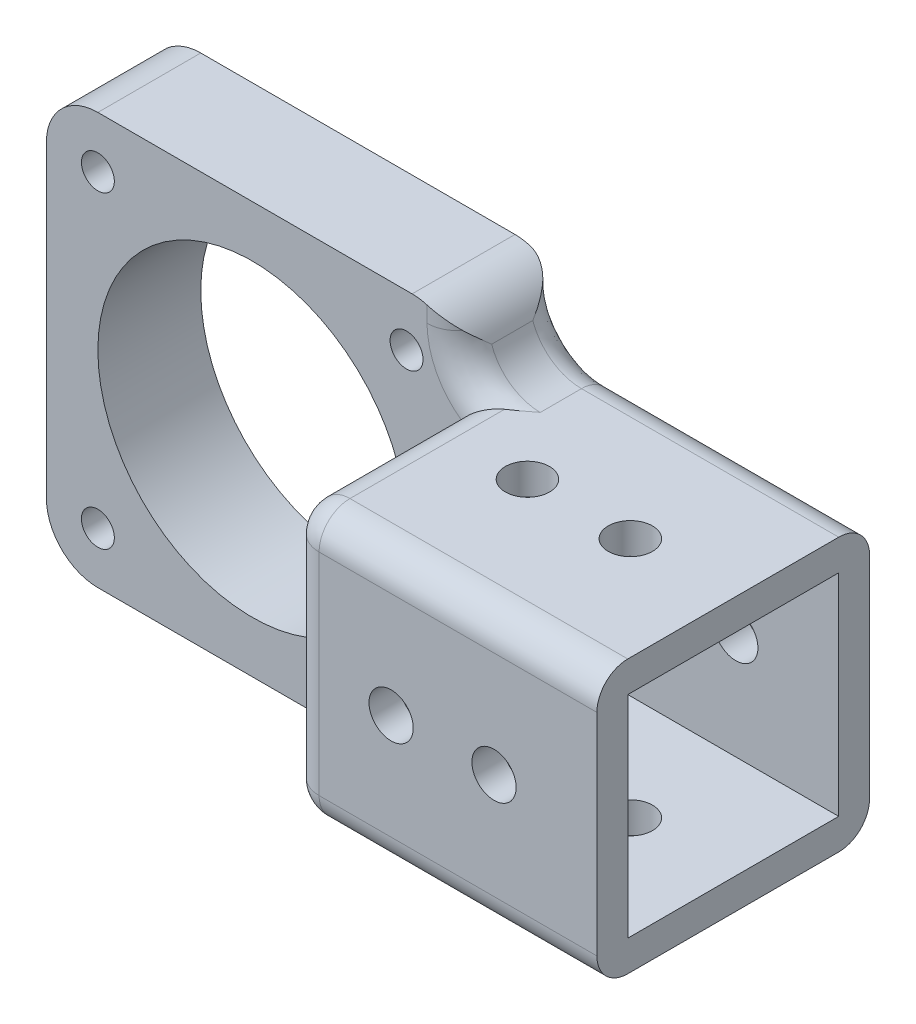
from build123d import *

# Parameters (mm, degrees)
SKETCH_1_W           = 17.5
SKETCH_1_H           = 17.5
EXTRUDE_1_DEPTH      = 30
SKETCH_2_W           = 20.5
SKETCH_2_H           = 20.5
SKETCH_2_W_2         = 17.5
SKETCH_2_H_2         = 17.5
EXTRUDE_2_DEPTH      = 2
SKETCH_3_W           = 26.5
SKETCH_3_H           = 26.5
SKETCH_3_W_2         = 20.5
SKETCH_3_H_2         = 20.5
EXTRUDE_3_DEPTH      = 30
SKETCH_4_R           = 2.15
CUT_EXTRUDE_6_DEPTH  = 43.164113888
SKETCH_6_W           = 10
SKETCH_6_H           = 26.5
SKETCH_6_H_2         = 6.75
EXTRUDE_5_DEPTH      = 40
SKETCH_14_R          = 1.6
CUT_EXTRUDE_9_DEPTH  = 52.983170353
FILLET_START         = -13.25
FILLET_25_DEPTH      = 10
FILLET_26_DEPTH      = 10
FILLET_28_R          = 3
FILLET_29_R          = 3
FILLET_30_R          = 3
FILLET_31_R          = 3
FILLET_32_R          = 3
FILLET_33_R          = 3
FILLET_34_R          = 3
FILLET_35_R          = 5
FILLET_START_2       = -14
FILLET_36_DEPTH      = 12
FILLET_37_DEPTH      = 12
FILLET_38_R          = 5
SKETCH_5_R           = 2.15
CUT_EXTRUDE_10_DEPTH = 52.983170469
SKETCH_15_W          = 17.5
SKETCH_15_H          = 17.5
CUT_EXTRUDE_12_DEPTH = 28


with BuildPart() as part:
    # 草图1 → 凸台-拉伸1 (new body)
    with BuildSketch(Plane(origin=(0, 0, 0), x_dir=(0, 0, -1), z_dir=(1, 0, 0))):
        Rectangle(SKETCH_1_W, SKETCH_1_H)
    extrude(amount=EXTRUDE_1_DEPTH)

    # 草图2 → 凸台-拉伸2 (add)
    with BuildSketch(Plane.ZY):
        Rectangle(SKETCH_2_W, SKETCH_2_H)
        Rectangle(SKETCH_2_W_2, SKETCH_2_H_2, mode=Mode.SUBTRACT)
    extrude(amount=-EXTRUDE_2_DEPTH)

    # 草图3 → 凸台-拉伸3 (add)
    with BuildSketch(Plane.ZY):
        Rectangle(SKETCH_3_W, SKETCH_3_H)
        Rectangle(SKETCH_3_W_2, SKETCH_3_H_2, mode=Mode.SUBTRACT)
    extrude(amount=-EXTRUDE_3_DEPTH)

    # 草图4 → 切除-拉伸6 (cut, through all)
    with BuildSketch(Plane(origin=(0, 13.25, 0), x_dir=(1, 0, 0), z_dir=(0, 1, 0))):
        with Locations(Location((10, 0, 0), (0, 0, 270))):
            Circle(SKETCH_4_R)
        with Locations(Location((20, 0, 0), (0, 0, 270))):
            Circle(SKETCH_4_R)
    extrude(amount=-CUT_EXTRUDE_6_DEPTH, mode=Mode.SUBTRACT)

    # 草图6 → 凸台-拉伸5 (add)
    with BuildSketch(Plane.ZY):
        with Locations((-8.25, 0)):
            Rectangle(SKETCH_6_W, SKETCH_6_H)
        with Locations((-8.25, 16.625)):
            Rectangle(SKETCH_6_W, SKETCH_6_H_2)
        with Locations((-8.25, -16.625)):
            Rectangle(SKETCH_6_W, SKETCH_6_H_2)
    extrude(amount=EXTRUDE_5_DEPTH)

    # 草图14 → 切除-拉伸9 (cut, through all)
    with BuildSketch(Plane(origin=(0, 0, -13.25), x_dir=(-1, 0, 0), z_dir=(0, 0, -1))):
        with BuildLine():
            ThreePointArc((20, 15), (5, 0), (20, -15))
            Line((20, -15), (20, 15))
        make_face()
        with BuildLine():
            Line((20, 15), (20, -15))
            ThreePointArc((20, -15), (30.606601718, -10.606601718), (35, 0))
            ThreePointArc((35, 0), (30.606601718, 10.606601718), (20, 15))
        make_face()
        with Locations((5, -15)):
            Circle(SKETCH_14_R)
        with Locations((35, -15)):
            Circle(SKETCH_14_R)
        with Locations((35, 15)):
            Circle(SKETCH_14_R)
        with Locations((5, 15)):
            Circle(SKETCH_14_R)
    extrude(amount=-CUT_EXTRUDE_9_DEPTH, mode=Mode.SUBTRACT)

    # 圆角25: read off the stored shape, not the designer's step
    # 圆角25 outline → 圆角25 (add)
    with BuildSketch(Plane.XY.offset(FILLET_START)):
        with BuildLine():
            add(Edge.make_bspline(
                [(0, 18.25), (0, 13.25), (5, 13.25)],
                knots=[0, 0, 0, 1, 1, 1], degree=2, weights=[1, 0.707106781, 1]))
            Line((0, 18.25), (0, 13.25))
            Line((0, 13.25), (5, 13.25))
        make_face()
    extrude(amount=FILLET_25_DEPTH)

    # 圆角26: read off the stored shape, not the designer's step
    # 圆角26 outline → 圆角26 (add)
    with BuildSketch(Plane.XY.offset(FILLET_START)):
        with BuildLine():
            Line((0, -13.25), (0, -18.25))
            add(Edge.make_bspline(
                [(0, -18.25), (0, -13.25), (5, -13.25)],
                knots=[0, 0, 0, 1, 1, 1], degree=2, weights=[1, 0.707106781, 1]))
            Line((5, -13.25), (0, -13.25))
        make_face()
    extrude(amount=FILLET_26_DEPTH)

    # 圆角28
    fillet_28_edges = [part.edges().sort_by_distance(p)[0] for p in [
        (15, 13.25, 13.25),
        (0, 13.25, 5),
    ]]
    fillet(fillet_28_edges, radius=FILLET_28_R)

    # 圆角29
    # the kernel refuses this fillet: 3 mm, written as the material it takes off along each edge
    with BuildSketch(Plane(origin=(3, 10.25, 10.25), x_dir=(-1, 0, 0), z_dir=(0, 0, 1))) as fillet_29_piece_1_section:
        Polygon((0, 0), (FILLET_29_R, 0), (FILLET_29_R, -FILLET_29_R), (0, -FILLET_29_R), align=None)
    fillet_29_piece_1 = extrude(amount=FILLET_29_R, mode=Mode.PRIVATE)
    fillet_29_piece_1 = fillet_29_piece_1 - Plane(origin=(3, 10.25, 10.25), x_dir=(0.7071067811865475, -0.7071067811865475, 0), z_dir=(0, 0, 1)) * Sphere(FILLET_29_R, mode=Mode.PRIVATE)
    add(fillet_29_piece_1, mode=Mode.SUBTRACT)
    with BuildSketch(Plane(origin=(0, -20.75, 13.25), x_dir=(1, 0, 0), z_dir=(0, 1, 0))) as fillet_29_piece_2:
        with BuildLine():
            CenterArc((FILLET_29_R, FILLET_29_R), FILLET_29_R, 180, 90)
            Line((0, FILLET_29_R), (0, 0))
            Line((0, 0), (FILLET_29_R, 0))
        make_face()
    extrude(amount=31, mode=Mode.SUBTRACT)
    with BuildSketch(Plane(origin=(0, -13.25, -3.25), x_dir=(1, 0, 0), z_dir=(0, 0, 1))) as fillet_29_piece_3:
        with BuildLine():
            CenterArc((FILLET_29_R, FILLET_29_R), FILLET_29_R, 180, 90)
            Line((0, FILLET_29_R), (0, 0))
            Line((0, 0), (FILLET_29_R, 0))
        make_face()
    extrude(amount=24, mode=Mode.SUBTRACT)

    # 圆角30
    # the kernel refuses this fillet: 3 mm, written as the material it takes off along each edge
    with BuildSketch(Plane(origin=(3, -10.25, 10.25), x_dir=(0, -1, 0), z_dir=(0, 0, 1))) as fillet_30_piece_1_section:
        Polygon((0, 0), (FILLET_30_R, 0), (FILLET_30_R, -FILLET_30_R), (0, -FILLET_30_R), align=None)
    fillet_30_piece_1 = extrude(amount=FILLET_30_R, mode=Mode.PRIVATE)
    fillet_30_piece_1 = fillet_30_piece_1 - Plane(origin=(3, -10.25, 10.25), x_dir=(0.7071067811865475, 0.7071067811865475, 0), z_dir=(0, 0, 1)) * Sphere(FILLET_30_R, mode=Mode.PRIVATE)
    add(fillet_30_piece_1, mode=Mode.SUBTRACT)
    with BuildSketch(Plane(origin=(3, -13.25, 13.25), x_dir=(0, 1, 0), z_dir=(1, 0, 0))) as fillet_30_piece_2:
        with BuildLine():
            CenterArc((FILLET_30_R, -FILLET_30_R), FILLET_30_R, 90, 90)
            Line((0, -FILLET_30_R), (0, 0))
            Line((0, 0), (FILLET_30_R, 0))
        make_face()
    extrude(amount=34.5, mode=Mode.SUBTRACT)

    # 圆角31
    fillet_31_edges = [part.edges().sort_by_distance(p)[0] for p in [
        (0, -19.125, -13.25),
        (1.464466505, -14.714465683, -13.25),
        (17.5, -13.25, -13.25),
    ]]
    fillet(fillet_31_edges, radius=FILLET_31_R)

    # 圆角32
    fillet_32_edges = [part.edges().sort_by_distance(p)[0] for p in [
        (1.464466505, 14.714465683, -13.25),
        (17.5, 13.25, -13.25),
        (0, 19.125, -13.25),
    ]]
    fillet(fillet_32_edges, radius=FILLET_32_R)

    # 圆角33
    fillet_33_edges = [part.edges().sort_by_distance(p)[0] for p in [
        (0, 19.125, -3.25),
        (1.464466505, 14.714465683, -3.25),
    ]]
    fillet(fillet_33_edges, radius=FILLET_33_R)

    # 圆角34
    fillet_34_edges = [part.edges().sort_by_distance(p)[0] for p in [
        (1.464466505, -14.714465683, -3.25),
        (0, -19.125, -3.25),
    ]]
    fillet(fillet_34_edges, radius=FILLET_34_R)

    # 圆角35
    fillet_35_edges = [part.edges().sort_by_distance(p)[0] for p in [
        (-40, 20, -8.25),
    ]]
    fillet(fillet_35_edges, radius=FILLET_35_R)

    # 圆角36: read off the stored shape, not the designer's step
    # 圆角36 outline → 圆角36 (cut)
    with BuildSketch(Plane.XY.offset(FILLET_START_2)):
        with BuildLine():
            Line((0, 20), (-4.45714016, 20))
            ThreePointArc((-4.45714016, 20), (-1.55240265, 19.069705149), (0.27142992, 16.625))
            add(Edge.make_bspline(
                [(0, 18.25), (0, 17.414831015), (0.27142992, 16.625)],
                knots=[0, 0, 0, 0.220935453, 0.220935453, 0.220935453], degree=2, weights=[1, 0.935289504, 0.899172693]))
            Line((0, 18.25), (0, 20))
        make_face()
    extrude(amount=FILLET_36_DEPTH, mode=Mode.SUBTRACT)

    # 圆角37: read off the stored shape, not the designer's step
    # 圆角37 outline → 圆角37 (cut)
    with BuildSketch(Plane.XY.offset(FILLET_START_2)):
        with BuildLine():
            ThreePointArc((0.27142992, -16.625), (-1.55240265, -19.069705149), (-4.45714016, -20))
            Line((-4.45714016, -20), (0, -20))
            Line((0, -20), (0, -18.25))
            add(Edge.make_bspline(
                [(0, -18.25), (0, -17.414831015), (0.27142992, -16.625)],
                knots=[0, 0, 0, 0.220935453, 0.220935453, 0.220935453], degree=2, weights=[1, 0.935289504, 0.899172693]))
        make_face()
    extrude(amount=FILLET_37_DEPTH, mode=Mode.SUBTRACT)

    # 圆角38
    fillet_38_edges = [part.edges().sort_by_distance(p)[0] for p in [
        (-40, -20, -8.25),
    ]]
    fillet(fillet_38_edges, radius=FILLET_38_R)

    # 草图5 → 切除-拉伸10 (cut, through all)
    with BuildSketch(Plane(origin=(0, 0, -13.25), x_dir=(-1, 0, 0), z_dir=(0, 0, -1))):
        with Locations(Location((-20, 0, 0), (0, 0, 180))):
            Circle(SKETCH_5_R)
        with Locations(Location((-10, 0, 0), (0, 0, 180))):
            Circle(SKETCH_5_R)
    extrude(amount=-CUT_EXTRUDE_10_DEPTH, mode=Mode.SUBTRACT)

    # 草图15 → 切除-拉伸12 (cut)
    with BuildSketch(Plane(origin=(30, 0, 0), x_dir=(0, 0, -1), z_dir=(1, 0, 0))):
        Rectangle(SKETCH_15_W, SKETCH_15_H)
    extrude(amount=-CUT_EXTRUDE_12_DEPTH, mode=Mode.SUBTRACT)


solid = part.part
